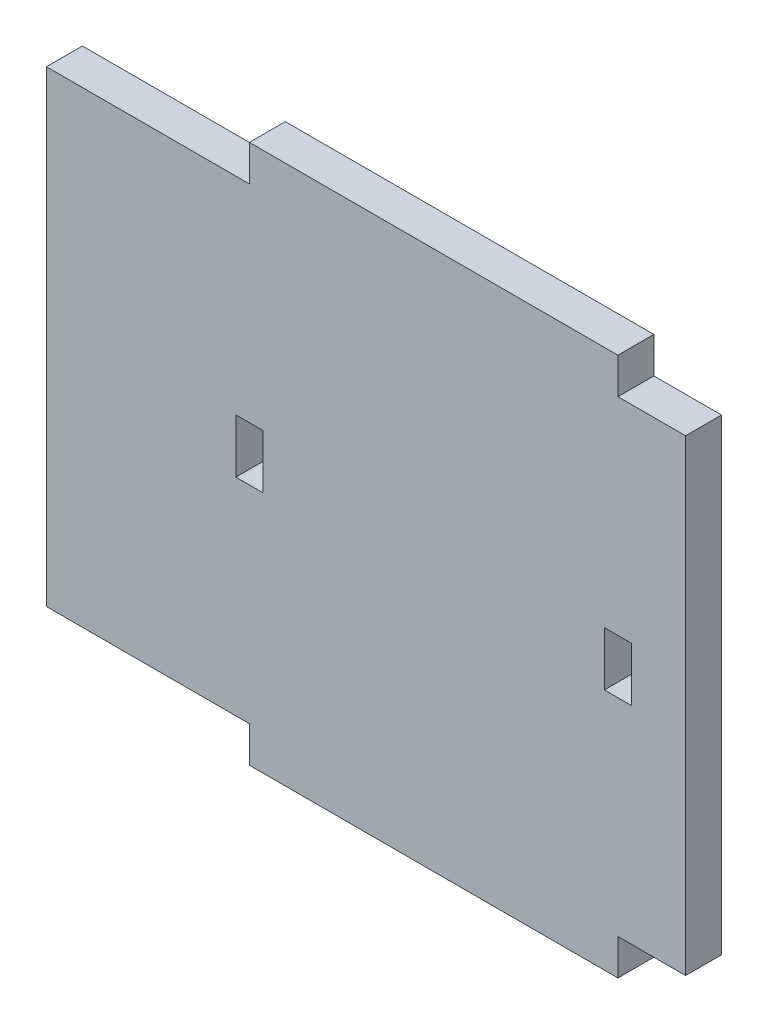
from build123d import *

# Parameters (mm, degrees)
BOSS_EXTRUDE1_DEPTH = 4
SKETCH2_W           = 3
SKETCH2_H           = 6
CUT_EXTRUDE1_DEPTH  = 10


with BuildPart() as part:
    # Sketch1 → Boss-Extrude1 (new body)
    with BuildSketch(Plane.XY):
        Polygon((-13.263157895, 0), (27.736842105, 0), (27.736842105, 4), (35.266842105, 4), (35.266842105, 56), (27.736842105, 56), (27.736842105, 60), (-13.263157895, 60), (-13.263157895, 56), (-35.833157895, 56), (-35.833157895, 4), (-13.263157895, 4), align=None)
    extrude(amount=BOSS_EXTRUDE1_DEPTH)

    # Sketch2 → Cut-Extrude1 (cut)
    with BuildSketch(Plane.XY.offset(4)):
        with Locations((-13.263157895, 30)):
            Rectangle(SKETCH2_W, SKETCH2_H)
        with Locations((27.736842105, 30)):
            Rectangle(SKETCH2_W, SKETCH2_H)
    extrude(amount=-CUT_EXTRUDE1_DEPTH, mode=Mode.SUBTRACT)


solid = part.part
